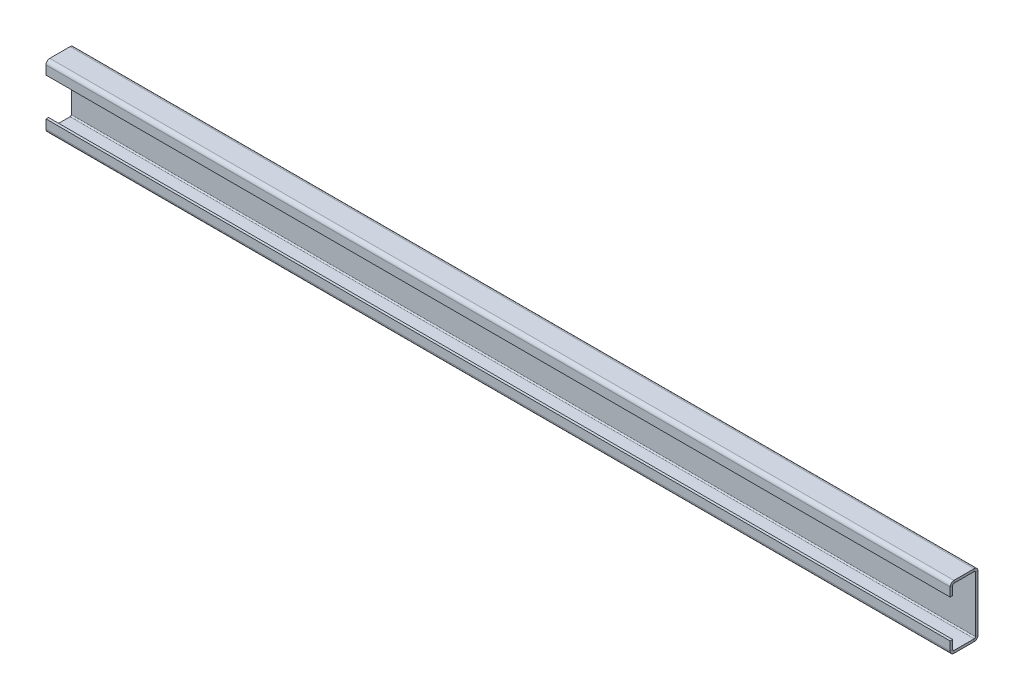
from build123d import *

# Parameters (mm, degrees)
BASEFLANGE_W                   = 715
BASEFLANGE_H                   = 50
BASE_FLANGE1_DEPTH             = 2
EDGE_FLANGE1_STRIP_W           = 10
EDGE_FLANGE1_STRIP_H           = 2
EDGE_FLANGE1_STRIP_CUT_DEPTH   = 715
EDGE_FLANGE1_STRIP_2_W         = 10
EDGE_FLANGE1_STRIP_2_H         = 2
EDGE_FLANGE1_STRIP_CUT_2_DEPTH = 715
EDGE_FLANGE1_DEPTH             = 715
EDGE_FLANGE1_BEND_DEPTH        = 715
EDGE_FLANGE2_STRIP_W           = 10
EDGE_FLANGE2_STRIP_H           = 2
EDGE_FLANGE2_STRIP_CUT_DEPTH   = 715
EDGE_FLANGE2_STRIP_2_W         = 10
EDGE_FLANGE2_STRIP_2_H         = 2
EDGE_FLANGE2_STRIP_CUT_2_DEPTH = 715
EDGE_FLANGE2_DEPTH             = 715
EDGE_FLANGE2_BEND_DEPTH        = 715


# Sheet-metal steps are written as plain solids
with BuildPart() as part:
    # BaseFlange → Base-Flange1 (new body)
    with BuildSketch(Plane.XY):
        Rectangle(BASEFLANGE_W, BASEFLANGE_H)
    extrude(amount=BASE_FLANGE1_DEPTH)

    # Edge-Flange1 strip (across the edge) → Edge-Flange1 strip cut (cut)
    with BuildSketch(Plane(origin=(357.5, 25, 2), x_dir=(0, -1, 0), z_dir=(-1, 0, 0))):
        with Locations((-2, -1)):
            Rectangle(EDGE_FLANGE1_STRIP_W, EDGE_FLANGE1_STRIP_H)
    extrude(amount=EDGE_FLANGE1_STRIP_CUT_DEPTH, mode=Mode.SUBTRACT)

    # Edge-Flange1 strip 2 (across the edge) → Edge-Flange1 strip cut 2 (cut)
    with BuildSketch(Plane(origin=(-357.5, -25, 2), x_dir=(0, 1, 0), z_dir=(1, 0, 0))):
        with Locations((-2, -1)):
            Rectangle(EDGE_FLANGE1_STRIP_2_W, EDGE_FLANGE1_STRIP_2_H)
    extrude(amount=EDGE_FLANGE1_STRIP_CUT_2_DEPTH, mode=Mode.SUBTRACT)

    # Edge-Flange1 section (across the edge) → Edge-Flange1 (add)
    with BuildSketch(Plane(origin=(357.5, 25, 2), x_dir=(0, -1, 0), z_dir=(-1, 0, 0))):
        with BuildLine():
            Line((0, 1), (0, 20))
            Line((0, 20), (2, 20))
            Line((2, 20), (2, 1))
            ThreePointArc((2, 1), (2.292893219, 0.292893219), (3, 0))
            Line((3, 0), (3, -2))
            ThreePointArc((3, -2), (0.878679656, -1.121320344), (0, 1))
        make_face()
    extrude(amount=EDGE_FLANGE1_DEPTH)

    # Edge-Flange1 section 2 (across the edge) → Edge-Flange1 bend (add)
    with BuildSketch(Plane(origin=(-357.5, -25, 2), x_dir=(0, 1, 0), z_dir=(1, 0, 0))):
        with BuildLine():
            Line((0, 1), (0, 20))
            Line((0, 20), (2, 20))
            Line((2, 20), (2, 1))
            ThreePointArc((2, 1), (2.292893219, 0.292893219), (3, 0))
            Line((3, 0), (3, -2))
            ThreePointArc((3, -2), (0.878679656, -1.121320344), (0, 1))
        make_face()
    extrude(amount=EDGE_FLANGE1_BEND_DEPTH)

    # Edge-Flange2 strip (across the edge) → Edge-Flange2 strip cut (cut)
    with BuildSketch(Plane(origin=(357.5, 23, 22), x_dir=(0, 0, -1), z_dir=(-1, 0, 0))):
        with Locations((-2, -1)):
            Rectangle(EDGE_FLANGE2_STRIP_W, EDGE_FLANGE2_STRIP_H)
    extrude(amount=EDGE_FLANGE2_STRIP_CUT_DEPTH, mode=Mode.SUBTRACT)

    # Edge-Flange2 strip 2 (across the edge) → Edge-Flange2 strip cut 2 (cut)
    with BuildSketch(Plane(origin=(-357.5, -23, 22), x_dir=(0, 0, -1), z_dir=(1, 0, 0))):
        with Locations((-2, -1)):
            Rectangle(EDGE_FLANGE2_STRIP_2_W, EDGE_FLANGE2_STRIP_2_H)
    extrude(amount=EDGE_FLANGE2_STRIP_CUT_2_DEPTH, mode=Mode.SUBTRACT)

    # Edge-Flange2 section (across the edge) → Edge-Flange2 (add)
    with BuildSketch(Plane(origin=(357.5, 23, 22), x_dir=(0, 0, -1), z_dir=(-1, 0, 0))):
        with BuildLine():
            Line((0, 1), (0, 8))
            Line((0, 8), (2, 8))
            Line((2, 8), (2, 1))
            ThreePointArc((2, 1), (2.292893219, 0.292893219), (3, 0))
            Line((3, 0), (3, -2))
            ThreePointArc((3, -2), (0.878679656, -1.121320344), (0, 1))
        make_face()
    extrude(amount=EDGE_FLANGE2_DEPTH)

    # Edge-Flange2 section 2 (across the edge) → Edge-Flange2 bend (add)
    with BuildSketch(Plane(origin=(-357.5, -23, 22), x_dir=(0, 0, -1), z_dir=(1, 0, 0))):
        with BuildLine():
            Line((0, 1), (0, 8))
            Line((0, 8), (2, 8))
            Line((2, 8), (2, 1))
            ThreePointArc((2, 1), (2.292893219, 0.292893219), (3, 0))
            Line((3, 0), (3, -2))
            ThreePointArc((3, -2), (0.878679656, -1.121320344), (0, 1))
        make_face()
    extrude(amount=EDGE_FLANGE2_BEND_DEPTH)


solid = part.part
